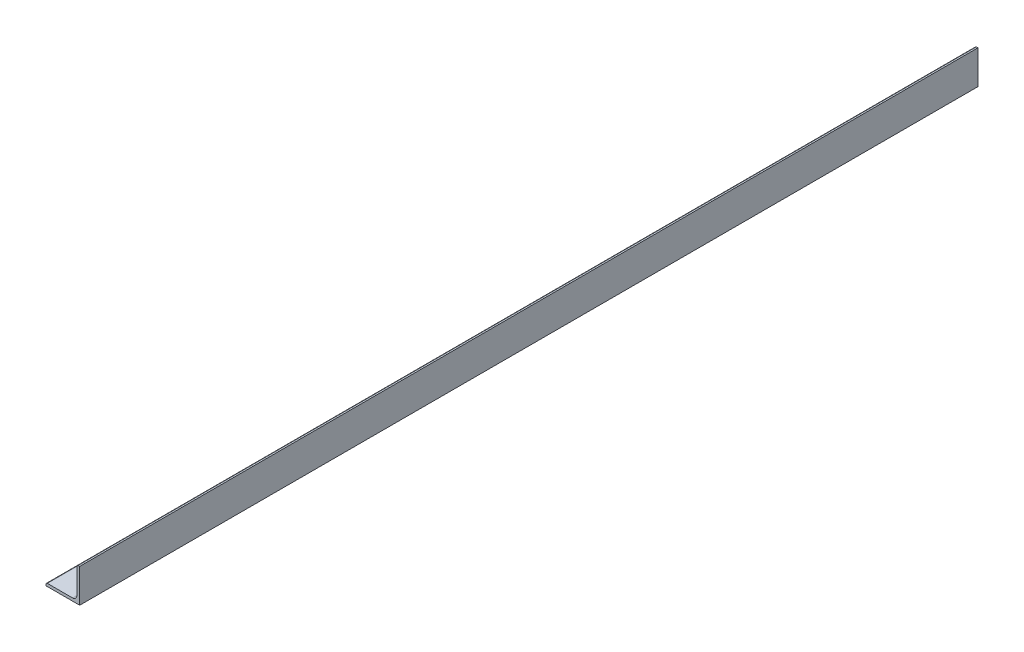
from build123d import *

# Parameters (mm, degrees)
BOSS_EXTRUDE1_DEPTH        = 254
F_10_CLEARANCE_HOLE1_D     = 4.9784
F_10_CLEARANCE_HOLE1_DEPTH = 3.302
F_10_CLEARANCE_HOLE1_TIP   = 1.495662253


with BuildPart() as part:
    # Sketch2 → Boss-Extrude1 (new, symmetric)
    with BuildSketch(Plane.XY):
        with BuildLine():
            Line((-9.525, -9.525), (9.525, -9.525))
            Line((9.525, -9.525), (9.525, 9.525))
            Line((9.525, 9.525), (8.73125, 9.525))
            ThreePointArc((8.73125, 9.525), (8.169983992, 9.292516008), (7.9375, 8.73125))
            Line((7.9375, 8.73125), (7.9375, -5.5499))
            ThreePointArc((7.9375, -5.5499), (7.238188151, -7.238188151), (5.5499, -7.9375))
            Line((5.5499, -7.9375), (-8.73125, -7.9375))
            ThreePointArc((-8.73125, -7.9375), (-9.292516008, -8.169983992), (-9.525, -8.73125))
            Line((-9.525, -8.73125), (-9.525, -9.525))
        make_face()
    extrude(amount=BOSS_EXTRUDE1_DEPTH, both=True)

    # #10 Clearance Hole1
    with Locations(Plane(origin=(0, -9.525, 0), x_dir=(-1, 0, 0), z_dir=(0, -1, 0))):
        with Locations((-3.136770585, 241.3), (-3.136770585, 215.9), (-3.175, -241.261770585), (-3.175, -215.861770585)):
            Hole(F_10_CLEARANCE_HOLE1_D / 2, depth=F_10_CLEARANCE_HOLE1_DEPTH)
            with Locations((0, 0, -(F_10_CLEARANCE_HOLE1_DEPTH + F_10_CLEARANCE_HOLE1_TIP / 2))):  # 118° drill point
                Cone(0, F_10_CLEARANCE_HOLE1_D / 2, F_10_CLEARANCE_HOLE1_TIP, mode=Mode.SUBTRACT)


solid = part.part
